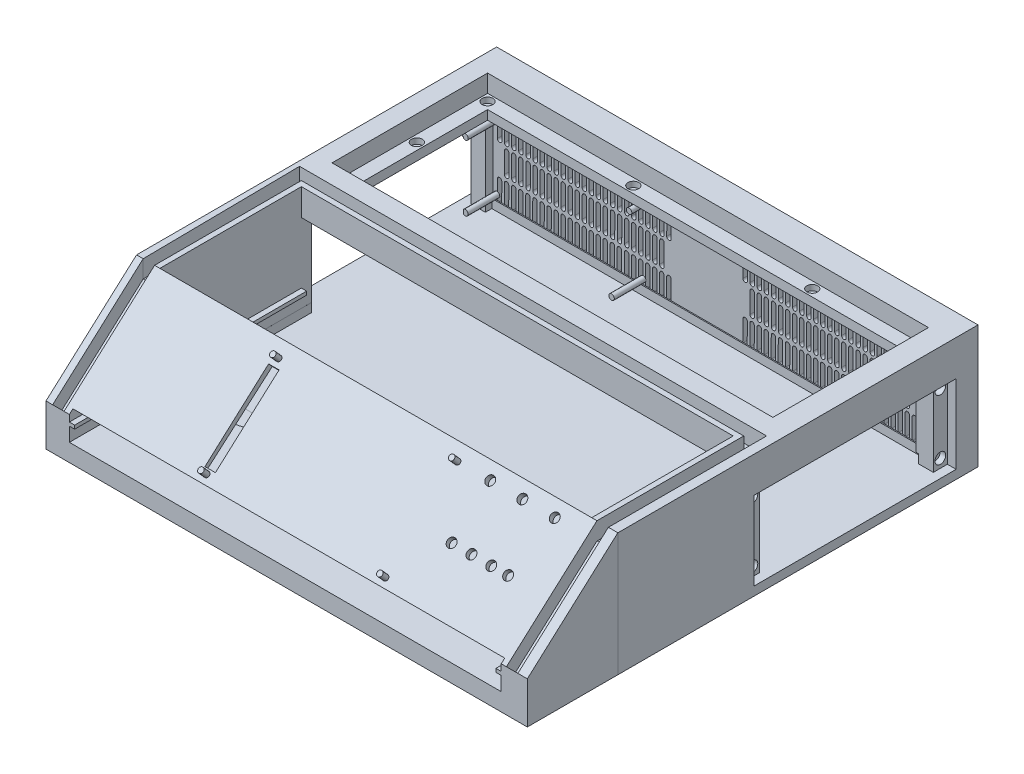
from build123d import *

# Parameters (mm, degrees)
BOSS_EXTRUDE1_DEPTH = 70
CUT_EXTRUDE1_DEPTH  = 10
SKETCH5_W           = 245.829798574
SKETCH5_H           = 84.902413675
CUT_EXTRUDE2_DEPTH  = 60
CUT_EXTRUDE3_DEPTH  = 4.66
CUT_EXTRUDE4_DEPTH  = 5
SKETCH9_W           = 3
SKETCH9_H           = 2
BOSS_EXTRUDE3_DEPTH = 85
SKETCH11_W          = 245.829798574
SKETCH11_H          = 44.743760381
CUT_EXTRUDE6_DEPTH  = 109
BOSS_EXTRUDE5_DEPTH = 274
SKETCH20_W          = 6.5
SKETCH20_H          = 69.236704604
CUT_EXTRUDE7_DEPTH  = 7.45
CUT_EXTRUDE9_DEPTH  = 346.159891301
SKETCH23_W          = 6.5
SKETCH23_H          = 69.236704604
CUT_EXTRUDE10_DEPTH = 7.45
CUT_EXTRUDE11_START = -5.5
CUT_EXTRUDE11_DEPTH = 243
CUT_EXTRUDE12_DEPTH = 5
CUT_EXTRUDE13_DEPTH = 5
SKETCH32_R          = 1.5
BOSS_EXTRUDE7_DEPTH = 5
SKETCH35_W          = 5.959514744
SKETCH35_H          = 48.700830397
CUT_EXTRUDE14_DEPTH = 10
SKETCH38_R          = 1.575
BOSS_EXTRUDE8_DEPTH = 18
SKETCH46_W          = 250.96666851
SKETCH46_H          = 88.54897829
CUT_EXTRUDE19_DEPTH = 10
SKETCH47_W          = 234.963937251
SKETCH47_H          = 72.547325464
CUT_EXTRUDE20_DEPTH = 19
SKETCH48_W          = 99
SKETCH48_H          = 44.740142715
CUT_EXTRUDE23_DEPTH = 37.5
SKETCH49_W          = 115.008314782
SKETCH49_H          = 44.740142715
CUT_EXTRUDE24_DEPTH = 5
SKETCH51_W          = 3
SKETCH51_H          = 6
CUT_EXTRUDE25_DEPTH = 5
SKETCH52_R          = 2.5
SKETCH52_R_2        = 2.496267115
CUT_EXTRUDE26_DEPTH = 5
SKETCH54_W          = 115.001673705
SKETCH54_H          = 44.740142715
CUT_EXTRUDE27_DEPTH = 5
SKETCH55_W          = 3
SKETCH55_H          = 6
CUT_EXTRUDE28_DEPTH = 5
SKETCH56_R          = 3.075
CUT_EXTRUDE29_DEPTH = 3.15
SKETCH57_R          = 3.075
CUT_EXTRUDE30_DEPTH = 3.15
CUT_EXTRUDE33_DEPTH = 15.44


with BuildPart() as part:
    # Sketch1 → Boss-Extrude1 (new body)
    with BuildSketch(Plane(origin=(0, 0, 0), x_dir=(1, 0, 0), z_dir=(0, 1, 0))):
        Polygon((263, -90), (0, -90), (-5.297672508, -90), (-5.297672508, 115), (268.719836564, 115), (268.719836564, 109.817232955), (268.719836564, 5.622236561), (268.719836564, -90), align=None)
    extrude(amount=BOSS_EXTRUDE1_DEPTH)

    # Sketch4 → Cut-Extrude1 (cut)
    with BuildSketch(Plane(origin=(0, 70, 0), x_dir=(1, 0, 0), z_dir=(0, 1, 0))):
        Polygon((-1.518607935, -90.000001141), (4.981392065, -90), (4.981392065, -6.438755439), (256.811190639, -6.438755439), (256.811190639, -90), (263.311190639, -90), (263.311190639, 0.061244561), (-2.567831993, 0.061244561), align=None)
    extrude(amount=-CUT_EXTRUDE1_DEPTH, mode=Mode.SUBTRACT)

    # Sketch5 → Cut-Extrude2 (cut)
    with BuildSketch(Plane(origin=(0, 70, 0), x_dir=(1, 0, 0), z_dir=(0, 1, 0))):
        with Locations((130.896291352, -51.889962277)):
            Rectangle(SKETCH5_W, SKETCH5_H)
    extrude(amount=-CUT_EXTRUDE2_DEPTH, mode=Mode.SUBTRACT)

    # Sketch6 → Cut-Extrude3 (cut)
    with BuildSketch(Plane(origin=(0, 10, 0), x_dir=(1, 0, 0), z_dir=(0, 1, 0))):
        with BuildLine():
            Line((34.259631344, -74.22492571), (34.259631344, -62.512880522))
            Line((34.259631344, -62.512880522), (56.559631344, -62.512880522))
            Line((56.559631344, -62.512880522), (56.559631344, -74.22492571))
            ThreePointArc((56.559631344, -74.22492571), (45.409631344, -85.37492571), (34.259631344, -74.22492571))
        make_face()
        with BuildLine():
            Line((120.707766281, -74.522104322), (120.707766281, -62.512880522))
            Line((120.707766281, -62.512880522), (143.007766281, -62.512880522))
            Line((143.007766281, -62.512880522), (143.007766281, -74.522104322))
            ThreePointArc((143.007766281, -74.522104322), (131.857766281, -85.672104322), (120.707766281, -74.522104322))
        make_face()
        with BuildLine():
            Line((206.833549657, -74.264123819), (206.833549657, -62.512880522))
            Line((206.833549657, -62.512880522), (229.133549657, -62.512880522))
            Line((229.133549657, -62.512880522), (229.133549657, -74.264123819))
            ThreePointArc((229.133549657, -74.264123819), (217.983549657, -85.414123819), (206.833549657, -74.264123819))
        make_face()
    extrude(amount=-CUT_EXTRUDE3_DEPTH, mode=Mode.SUBTRACT)

    # Sketch7 → Cut-Extrude4 (cut)
    with BuildSketch(Plane(origin=(0, 10, 0), x_dir=(1, 0, 0), z_dir=(0, 1, 0))):
        Polygon((7.981392065, -70.253012436), (8, 98.962802173), (255.25, 98.962802173), (253.811190639, -70.717283821), align=None)
    extrude(amount=-CUT_EXTRUDE4_DEPTH, mode=Mode.SUBTRACT)

    # Sketch9 → Boss-Extrude3 (add)
    with BuildSketch(Plane.XY.offset(90)):
        with Locations((9.481392065, 19)):
            Rectangle(SKETCH9_W, SKETCH9_H)
    boss_extrude3 = extrude(amount=-BOSS_EXTRUDE3_DEPTH)

    # Mirror1: Boss-Extrude3 across plane
    add(boss_extrude3.mirror(Plane(origin=(130.896291352, 0, 0), x_dir=(0, 0, 1), z_dir=(1, 0, 0))))

    # Sketch11 → Cut-Extrude6 (cut)
    with BuildSketch(Plane.XY.offset(9.438755439)):
        with Locations((130.896291352, 32.371880191)):
            Rectangle(SKETCH11_W, SKETCH11_H)
    extrude(amount=-CUT_EXTRUDE6_DEPTH, mode=Mode.SUBTRACT)

    # Sketch19 → Boss-Extrude5 (add)
    with BuildSketch(Plane.ZY.offset(5.297672508)):
        Polygon((90, 70), (141.535887712, 23.763936779), (141.535887712, 0), (90, 0), align=None)
    extrude(amount=-BOSS_EXTRUDE5_DEPTH)

    # Sketch20 → Cut-Extrude7 (cut)
    with BuildSketch(Plane(origin=(0, 83.519631011, 74.93067668), x_dir=(1, 0, 0), z_dir=(0, 0.7443434520309503, 0.6677969941671259))):
        with Locations((260.061190639, -54.863473393)):
            Rectangle(SKETCH20_W, SKETCH20_H)
    extrude(amount=-CUT_EXTRUDE7_DEPTH, mode=Mode.SUBTRACT)

    # Sketch22 → Cut-Extrude9 (cut, through all)
    with BuildSketch(Plane(origin=(0, 0, 90), x_dir=(-1, 0, 0), z_dir=(0, 0, -1))):
        Polygon((-253.840928546, 22.97086858), (-253.840928546, 25.555278288), (-8.001338449, 25.555278288), (-8.001338449, 22.97086858), (-8.001338449, 19.995349822), (-11.001338449, 19.995349822), (-11.001338449, 17.978106602), (-8.001338449, 17.978106602), (-8.001338449, 10), (-253.840928546, 10), (-253.840928546, 18), (-250.840928546, 18), (-250.840928546, 20), (-253.840928546, 20), align=None)
    extrude(amount=-CUT_EXTRUDE9_DEPTH, mode=Mode.SUBTRACT)

    # Sketch23 → Cut-Extrude10 (cut)
    with BuildSketch(Plane(origin=(0, 83.519631011, 74.93067668), x_dir=(1, 0, 0), z_dir=(0, 0.7443434520309503, 0.667796994167126))):
        with Locations((1.731392065, -54.863473393)):
            Rectangle(SKETCH23_W, SKETCH23_H)
    extrude(amount=-CUT_EXTRUDE10_DEPTH, mode=Mode.SUBTRACT)

    # Sketch26 → Cut-Extrude11 (cut)
    with BuildSketch(Plane.ZY.offset(-4.981392065).offset(CUT_EXTRUDE11_START)):
        Polygon((88.641700654, 66.783619732), (134.470436586, 26.948873274), (134.470436586, 21.410807665), (88.641700654, 21.3490784), align=None)
    extrude(amount=-CUT_EXTRUDE11_DEPTH, mode=Mode.SUBTRACT)

    # Sketch30 → Cut-Extrude12 (cut)
    with BuildSketch(Plane(origin=(0, 10, 0), x_dir=(1, 0, 0), z_dir=(0, 1, 0))):
        Polygon((88.314745977, -77.905708578), (84.07588093, -77.905708578), (84.07588093, -74.335398656), (84.57588093, -74.335398656), (84.57588093, -69.534898582), (87.804476446, -69.534898582), (87.804476446, -74.335398656), (88.314745977, -74.335398656), align=None)
    extrude(amount=-CUT_EXTRUDE12_DEPTH, mode=Mode.SUBTRACT)

    # Sketch31 → Cut-Extrude13 (cut)
    with BuildSketch(Plane(origin=(0, 10, 0), x_dir=(1, 0, 0), z_dir=(0, 1, 0))):
        Polygon((179.452231856, -78.850570011), (175.213366808, -78.850570011), (175.213366808, -75.280260088), (175.713366808, -75.280260088), (175.713366808, -70.479760014), (178.941962324, -70.479760014), (178.941962324, -75.280260088), (179.452231856, -75.280260088), align=None)
    extrude(amount=-CUT_EXTRUDE13_DEPTH, mode=Mode.SUBTRACT)

    # Sketch32 → Boss-Extrude7 (add)
    with BuildSketch(Plane(origin=(0, 83.519631011, 74.93067668), x_dir=(1, 0, 0), z_dir=(0, 0.7443434520309503, 0.667796994167126))):
        with Locations((81.180008505, -27.716796443)):
            Circle(SKETCH32_R)
        with Locations((81.180008505, -82.709942193)):
            Circle(SKETCH32_R)
        with Locations((183.023154256, -82.709942193)):
            Circle(SKETCH32_R)
        with Locations((183.023154256, -27.716796443)):
            Circle(SKETCH32_R)
    extrude(amount=BOSS_EXTRUDE7_DEPTH)

    # Sketch35 → Cut-Extrude14 (cut)
    with BuildSketch(Plane(origin=(0, 83.519631011, 74.93067668), x_dir=(1, 0, 0), z_dir=(0, 0.7443434520309503, 0.667796994167126))):
        with Locations((81.377076755, -56.021290861)):
            Rectangle(SKETCH35_W, SKETCH35_H)
    extrude(amount=-CUT_EXTRUDE14_DEPTH, mode=Mode.SUBTRACT)

    # Sketch38 → Boss-Extrude8 (add)
    with BuildSketch(Plane.XY.offset(-99.561244561)):
        with Locations((10.341559759, 12.837320316)):
            Circle(SKETCH38_R)
        with Locations((10.341559759, 50.187320316)):
            Circle(SKETCH38_R)
        with Locations((93.541559759, 12.837320316)):
            Circle(SKETCH38_R)
        with Locations((93.541559759, 50.187320316)):
            Circle(SKETCH38_R)
    extrude(amount=BOSS_EXTRUDE8_DEPTH)

    # Sketch46 → Cut-Extrude19 (cut)
    with BuildSketch(Plane(origin=(0, 70, 0), x_dir=(1, 0, 0), z_dir=(0, 1, 0))):
        with Locations((130.46472632, 55.286755416)):
            Rectangle(SKETCH46_W, SKETCH46_H)
    extrude(amount=-CUT_EXTRUDE19_DEPTH, mode=Mode.SUBTRACT)

    # Sketch47 → Cut-Extrude20 (cut)
    with BuildSketch(Plane(origin=(0, 60, 0), x_dir=(1, 0, 0), z_dir=(0, 1, 0))):
        with Locations((130.464726321, 55.286755416)):
            Rectangle(SKETCH47_W, SKETCH47_H)
    extrude(amount=-CUT_EXTRUDE20_DEPTH, mode=Mode.SUBTRACT)

    # Sketch48 → Cut-Extrude23 (cut)
    with BuildSketch(Plane.ZY.offset(-253.811190639)):
        with Locations((-45.061244561, 27.370071358)):
            Rectangle(SKETCH48_W, SKETCH48_H)
    cut_extrude23 = extrude(amount=-CUT_EXTRUDE23_DEPTH, mode=Mode.SUBTRACT)

    # Sketch49 → Cut-Extrude24 (cut)
    with BuildSketch(Plane(origin=(268.719836564, 0, 0), x_dir=(0, 0, -1), z_dir=(1, 0, 0))):
        with Locations((45.061244561, 27.370071358)):
            Rectangle(SKETCH49_W, SKETCH49_H)
    extrude(amount=-CUT_EXTRUDE24_DEPTH, mode=Mode.SUBTRACT)

    # Sketch51 → Cut-Extrude25 (cut)
    with BuildSketch(Plane(origin=(0, 0, 12.44291283), x_dir=(-1, 0, 0), z_dir=(0, 0, -1))):
        with Locations((-266.219836564, 38.555107036)):
            Rectangle(SKETCH51_W, SKETCH51_H)
        with Locations((-266.219836564, 16.185035679)):
            Rectangle(SKETCH51_W, SKETCH51_H)
    extrude(amount=-CUT_EXTRUDE25_DEPTH, mode=Mode.SUBTRACT)

    # Sketch52 → Cut-Extrude26 (cut)
    with BuildSketch(Plane(origin=(0, 83.519631011, 74.93067668), x_dir=(1, 0, 0), z_dir=(0, 0.7443434520309503, 0.667796994167126))):
        with Locations((201.623437155, -27.716796443)):
            Circle(SKETCH52_R)
        with Locations((219.917172447, -27.716796443)):
            Circle(SKETCH52_R)
        with Locations((238.364181543, -27.716796443)):
            Circle(SKETCH52_R)
        with Locations((212.919064307, -57.258078985)):
            Circle(SKETCH52_R)
        with Locations((224.201483548, -57.258078985)):
            Circle(SKETCH52_R_2)
        with Locations((201.623437155, -57.258078985)):
            Circle(SKETCH52_R)
        with Locations((233.778350435, -57.258078985)):
            Circle(SKETCH52_R)
    extrude(amount=-CUT_EXTRUDE26_DEPTH, mode=Mode.SUBTRACT)

    # Mirror5: Cut-Extrude23 across plane
    add(cut_extrude23.mirror(Plane(origin=(131.375620282, 0, 0.38196174), x_dir=(-0.0029073897035308822, 0, 0.9999957735336243), z_dir=(-0.9999957735336245, 0, -0.0029073897035308822))), mode=Mode.SUBTRACT)

    # Sketch54 → Cut-Extrude27 (cut)
    with BuildSketch(Plane.ZY.offset(5.297672508)):
        with Locations((-45.856747955, 27.370071358)):
            Rectangle(SKETCH54_W, SKETCH54_H)
    extrude(amount=-CUT_EXTRUDE27_DEPTH, mode=Mode.SUBTRACT)

    # Sketch55 → Cut-Extrude28 (cut)
    with BuildSketch(Plane(origin=(0, 0, 11.644088898), x_dir=(-1, 0, 0), z_dir=(0, 0, -1))):
        with Locations((2.723443809, 39.496335497)):
            Rectangle(SKETCH55_W, SKETCH55_H)
        with Locations((2.723443809, 17.12626414)):
            Rectangle(SKETCH55_W, SKETCH55_H)
    extrude(amount=-CUT_EXTRUDE28_DEPTH, mode=Mode.SUBTRACT)

    # Sketch56 → Cut-Extrude29 (cut)
    with BuildSketch(Plane(origin=(0, 60, 0), x_dir=(1, 0, 0), z_dir=(0, 1, 0))):
        with Locations((8.98207488, 95.560831355)):
            Circle(SKETCH56_R)
        with Locations((8.98207488, 55.286755416)):
            Circle(SKETCH56_R)
        with Locations((8.98207488, 15.012679477)):
            Circle(SKETCH56_R)
        with Locations((91.966559759, 15.012679477)):
            Circle(SKETCH56_R)
        with Locations((193.801312563, 15.012679477)):
            Circle(SKETCH56_R)
        with Locations((251.94737776, 15.012679477)):
            Circle(SKETCH56_R)
        with Locations((251.94737776, 55.286755416)):
            Circle(SKETCH56_R)
        with Locations((251.94737776, 95.560831355)):
            Circle(SKETCH56_R)
        with Locations((193.801312563, 95.560831355)):
            Circle(SKETCH56_R)
        with Locations((91.966559759, 95.560831355)):
            Circle(SKETCH56_R)
    extrude(amount=-CUT_EXTRUDE29_DEPTH, mode=Mode.SUBTRACT)

    # Sketch57 → Cut-Extrude30 (cut)
    with BuildSketch(Plane(origin=(263.719836564, 0, 0), x_dir=(0, 0, -1), z_dir=(1, 0, 0))):
        with Locations((-8.440834134, 44.268535884)):
            Circle(SKETCH57_R)
        with Locations((-8.440834134, 10)):
            Circle(SKETCH57_R)
        with Locations((98.563323257, 44.268535884)):
            Circle(SKETCH57_R)
        with Locations((98.563323257, 10)):
            Circle(SKETCH57_R)
    cut_extrude30 = extrude(amount=-CUT_EXTRUDE30_DEPTH, mode=Mode.SUBTRACT)

    # Mirror6: Cut-Extrude23, Cut-Extrude30 across plane
    add(cut_extrude23.mirror(Plane(origin=(131.375620282, 0, 0.38196174), x_dir=(-0.0029073897035308822, 0, 0.9999957735336243), z_dir=(-0.9999957735336245, 0, -0.0029073897035308822))), mode=Mode.SUBTRACT)
    add(cut_extrude30.mirror(Plane(origin=(131.375620282, 0, 0.38196174), x_dir=(-0.0029073897035308822, 0, 0.9999957735336243), z_dir=(-0.9999957735336245, 0, -0.0029073897035308822))), mode=Mode.SUBTRACT)

    # Sketch60 → Cut-Extrude33 (cut)
    with BuildSketch(Plane(origin=(0, 0, -115), x_dir=(-1, 0, 0), z_dir=(0, 0, -1))):
        with BuildLine():
            Line((-249.159484018, 9.54937519), (-249.220952032, 21.420747486))
            ThreePointArc((-249.220952032, 21.420747486), (-247.955896105, 22.698972102), (-246.677671489, 21.433916174))
            Line((-246.677671489, 21.433916174), (-246.616203476, 9.562543878))
            ThreePointArc((-246.616203476, 9.562543878), (-247.881259403, 8.284319262), (-249.159484018, 9.54937519))
        make_face()
        with BuildLine():
            Line((-245.134484278, 9.491544331), (-245.195952292, 21.362916627))
            ThreePointArc((-245.195952292, 21.362916627), (-243.930896365, 22.641141243), (-242.652671749, 21.376085316))
            Line((-242.652671749, 21.376085316), (-242.591203735, 9.504713019))
            ThreePointArc((-242.591203735, 9.504713019), (-243.856259663, 8.226488404), (-245.134484278, 9.491544331))
        make_face()
        with BuildLine():
            Line((-241.14188779, 9.547292216), (-241.203355803, 21.418664512))
            ThreePointArc((-241.203355803, 21.418664512), (-239.938299876, 22.696889128), (-238.660075261, 21.431833201))
            Line((-238.660075261, 21.431833201), (-238.598607247, 9.560460904))
            ThreePointArc((-238.598607247, 9.560460904), (-239.863663174, 8.282236289), (-241.14188779, 9.547292216))
        make_face()
        with BuildLine():
            Line((-237.148701325, 9.523553629), (-237.210169338, 21.394925925))
            ThreePointArc((-237.210169338, 21.394925925), (-235.945113411, 22.673150541), (-234.666888796, 21.408094613))
            Line((-234.666888796, 21.408094613), (-234.605420782, 9.536722317))
            ThreePointArc((-234.605420782, 9.536722317), (-235.870476709, 8.258497702), (-237.148701325, 9.523553629))
        make_face()
        with BuildLine():
            Line((-233.156104836, 9.579301514), (-233.21757285, 21.45067381))
            ThreePointArc((-233.21757285, 21.45067381), (-231.952516923, 22.728898426), (-230.674292307, 21.463842498))
            Line((-230.674292307, 21.463842498), (-230.612824294, 9.592470202))
            ThreePointArc((-230.612824294, 9.592470202), (-231.877880221, 8.314245586), (-233.156104836, 9.579301514))
        make_face()
        with BuildLine():
            Line((-229.117369553, 9.584775879), (-229.178837566, 21.456148176))
            ThreePointArc((-229.178837566, 21.456148176), (-227.913781639, 22.734372791), (-226.635557023, 21.469316864))
            Line((-226.635557023, 21.469316864), (-226.57408901, 9.597944568))
            ThreePointArc((-226.57408901, 9.597944568), (-227.839144937, 8.319719952), (-229.117369553, 9.584775879))
        make_face()
        with BuildLine():
            Line((-225.124773064, 9.640523764), (-225.186241078, 21.511896061))
            ThreePointArc((-225.186241078, 21.511896061), (-223.921185151, 22.790120676), (-222.642960535, 21.525064749))
            Line((-222.642960535, 21.525064749), (-222.581492522, 9.653692453))
            ThreePointArc((-222.581492522, 9.653692453), (-223.846548449, 8.375467837), (-225.124773064, 9.640523764))
        make_face()
        with BuildLine():
            Line((-221.02975139, 9.601683934), (-221.091219404, 21.47305623))
            ThreePointArc((-221.091219404, 21.47305623), (-219.826163477, 22.751280846), (-218.547938861, 21.486224919))
            Line((-218.547938861, 21.486224919), (-218.486470848, 9.614852622))
            ThreePointArc((-218.486470848, 9.614852622), (-219.751526775, 8.336628007), (-221.02975139, 9.601683934))
        make_face()
        with BuildLine():
            Line((-217.037154902, 9.657431819), (-217.098622916, 21.528804115))
            ThreePointArc((-217.098622916, 21.528804115), (-215.833566988, 22.807028731), (-214.555342373, 21.541972804))
            Line((-214.555342373, 21.541972804), (-214.493874359, 9.670600507))
            ThreePointArc((-214.493874359, 9.670600507), (-215.758930286, 8.392375892), (-217.037154902, 9.657431819))
        make_face()
        with BuildLine():
            Line((-212.944281909, 9.529492242), (-213.005749922, 21.400864539))
            ThreePointArc((-213.005749922, 21.400864539), (-211.740693995, 22.679089154), (-210.46246938, 21.414033227))
            Line((-210.46246938, 21.414033227), (-210.401001366, 9.542660931))
            ThreePointArc((-210.401001366, 9.542660931), (-211.666057293, 8.264436315), (-212.944281909, 9.529492242))
        make_face()
        with BuildLine():
            Line((-208.95168542, 9.585240127), (-209.013153434, 21.456612423))
            ThreePointArc((-209.013153434, 21.456612423), (-207.748097507, 22.734837039), (-206.469872891, 21.469781112))
            Line((-206.469872891, 21.469781112), (-206.408404878, 9.598408816))
            ThreePointArc((-206.408404878, 9.598408816), (-207.673460805, 8.3201842), (-208.95168542, 9.585240127))
        make_face()
        with BuildLine():
            Line((-196.978518724, 9.549570169), (-197.039986737, 21.420942465))
            ThreePointArc((-197.039986737, 21.420942465), (-195.77493081, 22.69916708), (-194.496706195, 21.434111153))
            Line((-194.496706195, 21.434111153), (-194.435238181, 9.562738857))
            ThreePointArc((-194.435238181, 9.562738857), (-195.700294108, 8.284514241), (-196.978518724, 9.549570169))
        make_face()
        with BuildLine():
            Line((-192.985922236, 9.605318053), (-193.047390249, 21.47669035))
            ThreePointArc((-193.047390249, 21.47669035), (-191.782334322, 22.754914965), (-190.504109706, 21.489859038))
            Line((-190.504109706, 21.489859038), (-190.442641693, 9.618486742))
            ThreePointArc((-190.442641693, 9.618486742), (-191.70769762, 8.340262126), (-192.985922236, 9.605318053))
        make_face()
        with BuildLine():
            Line((-188.960922495, 9.547487195), (-189.022390509, 21.418859491))
            ThreePointArc((-189.022390509, 21.418859491), (-187.757334582, 22.697084107), (-186.479109966, 21.43202818))
            Line((-186.479109966, 21.43202818), (-186.417641953, 9.560655883))
            ThreePointArc((-186.417641953, 9.560655883), (-187.68269788, 8.282431268), (-188.960922495, 9.547487195))
        make_face()
        with BuildLine():
            Line((-184.968326007, 9.60323508), (-185.029794021, 21.474607376))
            ThreePointArc((-185.029794021, 21.474607376), (-183.764738094, 22.752831992), (-182.486513478, 21.487776064))
            Line((-182.486513478, 21.487776064), (-182.425045464, 9.616403768))
            ThreePointArc((-182.425045464, 9.616403768), (-183.690101392, 8.338179153), (-184.968326007, 9.60323508))
        make_face()
        with BuildLine():
            Line((-180.975139542, 9.579496493), (-181.036607556, 21.450868789))
            ThreePointArc((-181.036607556, 21.450868789), (-179.771551628, 22.729093404), (-178.493327013, 21.464037477))
            Line((-178.493327013, 21.464037477), (-178.431858999, 9.592665181))
            ThreePointArc((-178.431858999, 9.592665181), (-179.696914926, 8.314440565), (-180.975139542, 9.579496493))
        make_face()
        with BuildLine():
            Line((-176.982543054, 9.635244377), (-177.044011067, 21.506616674))
            ThreePointArc((-177.044011067, 21.506616674), (-175.77895514, 22.784841289), (-174.500730524, 21.519785362))
            Line((-174.500730524, 21.519785362), (-174.439262511, 9.648413066))
            ThreePointArc((-174.439262511, 9.648413066), (-175.704318438, 8.37018845), (-176.982543054, 9.635244377))
        make_face()
        with BuildLine():
            Line((-205.005548151, 9.557405131), (-205.067016165, 21.428777428))
            ThreePointArc((-205.067016165, 21.428777428), (-203.801960238, 22.707002043), (-202.523735622, 21.441946116))
            Line((-202.523735622, 21.441946116), (-202.462267609, 9.57057382))
            ThreePointArc((-202.462267609, 9.57057382), (-203.727323536, 8.292349204), (-205.005548151, 9.557405131))
        make_face()
        with BuildLine():
            Line((-201.012951663, 9.613153016), (-201.074419677, 21.484525313))
            ThreePointArc((-201.074419677, 21.484525313), (-199.809363749, 22.762749928), (-198.531139134, 21.497694001))
            Line((-198.531139134, 21.497694001), (-198.46967112, 9.626321705))
            ThreePointArc((-198.46967112, 9.626321705), (-199.734727047, 8.348097089), (-201.012951663, 9.613153016))
        make_face()
        with BuildLine():
            Line((-172.94380777, 9.640718743), (-173.005275783, 21.512091039))
            ThreePointArc((-173.005275783, 21.512091039), (-171.740219856, 22.790315655), (-170.461995241, 21.525259728))
            Line((-170.461995241, 21.525259728), (-170.400527227, 9.653887432))
            ThreePointArc((-170.400527227, 9.653887432), (-171.665583154, 8.375662816), (-172.94380777, 9.640718743))
        make_face()
        with BuildLine():
            Line((-168.951211282, 9.696466628), (-169.012679295, 21.567838924))
            ThreePointArc((-169.012679295, 21.567838924), (-167.747623368, 22.84606354), (-166.469398752, 21.581007613))
            Line((-166.469398752, 21.581007613), (-166.407930739, 9.709635316))
            ThreePointArc((-166.407930739, 9.709635316), (-167.672986666, 8.431410701), (-168.951211282, 9.696466628))
        make_face()
        with BuildLine():
            Line((-164.856189608, 9.657626798), (-164.917657621, 21.528999094))
            ThreePointArc((-164.917657621, 21.528999094), (-163.652601694, 22.80722371), (-162.374377078, 21.542167783))
            Line((-162.374377078, 21.542167783), (-162.312909065, 9.670795486))
            ThreePointArc((-162.312909065, 9.670795486), (-163.577964992, 8.392570871), (-164.856189608, 9.657626798))
        make_face()
        with BuildLine():
            Line((-160.863593119, 9.713374683), (-160.925061133, 21.584746979))
            ThreePointArc((-160.925061133, 21.584746979), (-159.660005206, 22.862971595), (-158.38178059, 21.597915667))
            Line((-158.38178059, 21.597915667), (-158.320312577, 9.726543371))
            ThreePointArc((-158.320312577, 9.726543371), (-159.585368504, 8.448318756), (-160.863593119, 9.713374683))
        make_face()
        with BuildLine():
            Line((-156.770720126, 9.585435106), (-156.832188139, 21.456807402))
            ThreePointArc((-156.832188139, 21.456807402), (-155.567132212, 22.735032018), (-154.288907597, 21.469976091))
            Line((-154.288907597, 21.469976091), (-154.227439583, 9.598603794))
            ThreePointArc((-154.227439583, 9.598603794), (-155.49249551, 8.320379179), (-156.770720126, 9.585435106))
        make_face()
        with BuildLine():
            Line((-152.778123638, 9.641182991), (-152.839591651, 21.512555287))
            ThreePointArc((-152.839591651, 21.512555287), (-151.574535724, 22.790779903), (-150.296311108, 21.525723976))
            Line((-150.296311108, 21.525723976), (-150.234843095, 9.654351679))
            ThreePointArc((-150.234843095, 9.654351679), (-151.499899022, 8.376127064), (-152.778123638, 9.641182991))
        make_face()
        with BuildLine():
            Line((-245.214727534, 25.50584578), (-245.276195548, 37.377218076))
            ThreePointArc((-245.276195548, 37.377218076), (-244.011139621, 38.655442692), (-242.732915005, 37.390386764))
            Line((-242.732915005, 37.390386764), (-242.671446992, 25.519014468))
            ThreePointArc((-242.671446992, 25.519014468), (-243.936502919, 24.240789852), (-245.214727534, 25.50584578))
        make_face()
        with BuildLine():
            Line((-241.222131046, 25.561593664), (-241.28359906, 37.432965961))
            ThreePointArc((-241.28359906, 37.432965961), (-240.018543132, 38.711190576), (-238.740318517, 37.446134649))
            Line((-238.740318517, 37.446134649), (-238.678850503, 25.574762353))
            ThreePointArc((-238.678850503, 25.574762353), (-239.94390643, 24.296537737), (-241.222131046, 25.561593664))
        make_face()
        with BuildLine():
            Line((-237.228944581, 25.537855077), (-237.290412594, 37.409227374))
            ThreePointArc((-237.290412594, 37.409227374), (-236.025356667, 38.687451989), (-234.747132052, 37.422396062))
            Line((-234.747132052, 37.422396062), (-234.685664038, 25.551023766))
            ThreePointArc((-234.685664038, 25.551023766), (-235.950719965, 24.27279915), (-237.228944581, 25.537855077))
        make_face()
        with BuildLine():
            Line((-233.236348093, 25.593602962), (-233.297816106, 37.464975259))
            ThreePointArc((-233.297816106, 37.464975259), (-232.032760179, 38.743199874), (-230.754535563, 37.478143947))
            Line((-230.754535563, 37.478143947), (-230.69306755, 25.606771651))
            ThreePointArc((-230.69306755, 25.606771651), (-231.958123477, 24.328547035), (-233.236348093, 25.593602962))
        make_face()
        with BuildLine():
            Line((-109.396509909, 8.700901419), (-109.457977922, 20.572273715))
            ThreePointArc((-109.457977922, 20.572273715), (-108.192921995, 21.850498331), (-106.91469738, 20.585442404))
            Line((-106.91469738, 20.585442404), (-106.853229366, 8.714070108))
            ThreePointArc((-106.853229366, 8.714070108), (-108.118285293, 7.435845492), (-109.396509909, 8.700901419))
        make_face()
        with BuildLine():
            Line((-229.197612809, 25.599077328), (-229.259080822, 37.470449624))
            ThreePointArc((-229.259080822, 37.470449624), (-227.994024895, 38.74867424), (-226.71580028, 37.483618313))
            Line((-226.71580028, 37.483618313), (-226.654332266, 25.612246016))
            ThreePointArc((-226.654332266, 25.612246016), (-227.919388193, 24.334021401), (-229.197612809, 25.599077328))
        make_face()
        with BuildLine():
            Line((-225.20501632, 25.654825213), (-225.266484334, 37.526197509))
            ThreePointArc((-225.266484334, 37.526197509), (-224.001428407, 38.804422125), (-222.723203791, 37.539366198))
            Line((-222.723203791, 37.539366198), (-222.661735778, 25.667993901))
            ThreePointArc((-222.661735778, 25.667993901), (-223.926791705, 24.389769286), (-225.20501632, 25.654825213))
        make_face()
        with BuildLine():
            Line((-221.109994646, 25.615985383), (-221.17146266, 37.487357679))
            ThreePointArc((-221.17146266, 37.487357679), (-219.906406733, 38.765582295), (-218.628182117, 37.500526367))
            Line((-218.628182117, 37.500526367), (-218.566714104, 25.629154071))
            ThreePointArc((-218.566714104, 25.629154071), (-219.831770031, 24.350929455), (-221.109994646, 25.615985383))
        make_face()
        with BuildLine():
            Line((-217.117398158, 25.671733267), (-217.178866172, 37.543105564))
            ThreePointArc((-217.178866172, 37.543105564), (-215.913810245, 38.821330179), (-214.635585629, 37.556274252))
            Line((-214.635585629, 37.556274252), (-214.574117615, 25.684901956))
            ThreePointArc((-214.574117615, 25.684901956), (-215.839173543, 24.40667734), (-217.117398158, 25.671733267))
        make_face()
        with BuildLine():
            Line((-213.024525165, 25.543793691), (-213.085993178, 37.415165987))
            ThreePointArc((-213.085993178, 37.415165987), (-211.820937251, 38.693390603), (-210.542712636, 37.428334676))
            Line((-210.542712636, 37.428334676), (-210.481244622, 25.556962379))
            ThreePointArc((-210.481244622, 25.556962379), (-211.746300549, 24.278737764), (-213.024525165, 25.543793691))
        make_face()
        with BuildLine():
            Line((-209.031928677, 25.599541576), (-209.09339669, 37.470913872))
            ThreePointArc((-209.09339669, 37.470913872), (-207.828340763, 38.749138488), (-206.550116147, 37.48408256))
            Line((-206.550116147, 37.48408256), (-206.488648134, 25.612710264))
            ThreePointArc((-206.488648134, 25.612710264), (-207.753704061, 24.334485649), (-209.031928677, 25.599541576))
        make_face()
        with BuildLine():
            Line((-197.05876198, 25.563871617), (-197.120229994, 37.435243914))
            ThreePointArc((-197.120229994, 37.435243914), (-195.855174066, 38.713468529), (-194.576949451, 37.448412602))
            Line((-194.576949451, 37.448412602), (-194.515481437, 25.577040306))
            ThreePointArc((-194.515481437, 25.577040306), (-195.780537364, 24.29881569), (-197.05876198, 25.563871617))
        make_face()
        with BuildLine():
            Line((-193.066165492, 25.619619502), (-193.127633505, 37.490991798))
            ThreePointArc((-193.127633505, 37.490991798), (-191.862577578, 38.769216414), (-190.584352962, 37.504160487))
            Line((-190.584352962, 37.504160487), (-190.522884949, 25.63278819))
            ThreePointArc((-190.522884949, 25.63278819), (-191.787940876, 24.354563575), (-193.066165492, 25.619619502))
        make_face()
        with BuildLine():
            Line((-189.041165752, 25.561788643), (-189.102633765, 37.43316094))
            ThreePointArc((-189.102633765, 37.43316094), (-187.837577838, 38.711385555), (-186.559353222, 37.446329628))
            Line((-186.559353222, 37.446329628), (-186.497885209, 25.574957332))
            ThreePointArc((-186.497885209, 25.574957332), (-187.762941136, 24.296732716), (-189.041165752, 25.561788643))
        make_face()
        with BuildLine():
            Line((-185.048569263, 25.617536528), (-185.110037277, 37.488908825))
            ThreePointArc((-185.110037277, 37.488908825), (-183.84498135, 38.76713344), (-182.566756734, 37.502077513))
            Line((-182.566756734, 37.502077513), (-182.50528872, 25.630705217))
            ThreePointArc((-182.50528872, 25.630705217), (-183.770344648, 24.352480601), (-185.048569263, 25.617536528))
        make_face()
        with BuildLine():
            Line((-181.055382798, 25.593797941), (-181.116850812, 37.465170237))
            ThreePointArc((-181.116850812, 37.465170237), (-179.851794885, 38.743394853), (-178.573570269, 37.478338926))
            Line((-178.573570269, 37.478338926), (-178.512102255, 25.60696663))
            ThreePointArc((-178.512102255, 25.60696663), (-179.777158183, 24.328742014), (-181.055382798, 25.593797941))
        make_face()
        with BuildLine():
            Line((-177.06278631, 25.649545826), (-177.124254323, 37.520918122))
            ThreePointArc((-177.124254323, 37.520918122), (-175.859198396, 38.799142738), (-174.580973781, 37.534086811))
            Line((-174.580973781, 37.534086811), (-174.519505767, 25.662714514))
            ThreePointArc((-174.519505767, 25.662714514), (-175.784561694, 24.384489899), (-177.06278631, 25.649545826))
        make_face()
        with BuildLine():
            Line((-205.085791407, 25.57170658), (-205.147259421, 37.443078876))
            ThreePointArc((-205.147259421, 37.443078876), (-203.882203494, 38.721303492), (-202.603978878, 37.456247565))
            Line((-202.603978878, 37.456247565), (-202.542510865, 25.584875268))
            ThreePointArc((-202.542510865, 25.584875268), (-203.807566792, 24.306650653), (-205.085791407, 25.57170658))
        make_face()
        with BuildLine():
            Line((-201.093194919, 25.627454465), (-201.154662933, 37.498826761))
            ThreePointArc((-201.154662933, 37.498826761), (-199.889607005, 38.777051377), (-198.61138239, 37.51199545))
            Line((-198.61138239, 37.51199545), (-198.549914376, 25.640623153))
            ThreePointArc((-198.549914376, 25.640623153), (-199.814970303, 24.362398538), (-201.093194919, 25.627454465))
        make_face()
        with BuildLine():
            Line((-173.024051026, 25.655020192), (-173.08551904, 37.526392488))
            ThreePointArc((-173.08551904, 37.526392488), (-171.820463112, 38.804617104), (-170.542238497, 37.539561176))
            Line((-170.542238497, 37.539561176), (-170.480770483, 25.66818888))
            ThreePointArc((-170.480770483, 25.66818888), (-171.74582641, 24.389964265), (-173.024051026, 25.655020192))
        make_face()
        with BuildLine():
            Line((-169.031454538, 25.710768077), (-169.092922551, 37.582140373))
            ThreePointArc((-169.092922551, 37.582140373), (-167.827866624, 38.860364989), (-166.549642008, 37.595309061))
            Line((-166.549642008, 37.595309061), (-166.488173995, 25.723936765))
            ThreePointArc((-166.488173995, 25.723936765), (-167.753229922, 24.445712149), (-169.031454538, 25.710768077))
        make_face()
        with BuildLine():
            Line((-164.936432864, 25.671928246), (-164.997900877, 37.543300543))
            ThreePointArc((-164.997900877, 37.543300543), (-163.73284495, 38.821525158), (-162.454620334, 37.556469231))
            Line((-162.454620334, 37.556469231), (-162.393152321, 25.685096935))
            ThreePointArc((-162.393152321, 25.685096935), (-163.658208248, 24.406872319), (-164.936432864, 25.671928246))
        make_face()
        with BuildLine():
            Line((-160.943836375, 25.727676131), (-161.005304389, 37.599048428))
            ThreePointArc((-161.005304389, 37.599048428), (-159.740248462, 38.877273043), (-158.462023846, 37.612217116))
            Line((-158.462023846, 37.612217116), (-158.400555833, 25.74084482))
            ThreePointArc((-158.400555833, 25.74084482), (-159.66561176, 24.462620204), (-160.943836375, 25.727676131))
        make_face()
        with BuildLine():
            Line((-156.850963382, 25.599736555), (-156.912431396, 37.471108851))
            ThreePointArc((-156.912431396, 37.471108851), (-155.647375468, 38.749333467), (-154.369150853, 37.484277539))
            Line((-154.369150853, 37.484277539), (-154.307682839, 25.612905243))
            ThreePointArc((-154.307682839, 25.612905243), (-155.572738766, 24.334680627), (-156.850963382, 25.599736555))
        make_face()
        with BuildLine():
            Line((-249.267278891, 41.303946771), (-249.328746905, 53.175319068))
            ThreePointArc((-249.328746905, 53.175319068), (-248.063690978, 54.453543683), (-246.785466362, 53.188487756))
            Line((-246.785466362, 53.188487756), (-246.723998349, 41.31711546))
            ThreePointArc((-246.723998349, 41.31711546), (-247.989054276, 40.038890844), (-249.267278891, 41.303946771))
        make_face()
        with BuildLine():
            Line((-245.242279151, 41.246115913), (-245.303747165, 53.117488209))
            ThreePointArc((-245.303747165, 53.117488209), (-244.038691238, 54.395712825), (-242.760466622, 53.130656897))
            Line((-242.760466622, 53.130656897), (-242.698998609, 41.259284601))
            ThreePointArc((-242.698998609, 41.259284601), (-243.964054536, 39.981059985), (-245.242279151, 41.246115913))
        make_face()
        with BuildLine():
            Line((-241.249682663, 41.301863797), (-241.311150677, 53.173236094))
            ThreePointArc((-241.311150677, 53.173236094), (-240.046094749, 54.451460709), (-238.767870134, 53.186404782))
            Line((-238.767870134, 53.186404782), (-238.70640212, 41.315032486))
            ThreePointArc((-238.70640212, 41.315032486), (-239.971458047, 40.03680787), (-241.249682663, 41.301863797))
        make_face()
        with BuildLine():
            Line((-237.256496198, 41.27812521), (-237.317964211, 53.149497507))
            ThreePointArc((-237.317964211, 53.149497507), (-236.052908284, 54.427722122), (-234.774683669, 53.162666195))
            Line((-234.774683669, 53.162666195), (-234.713215655, 41.291293899))
            ThreePointArc((-234.713215655, 41.291293899), (-235.978271582, 40.013069283), (-237.256496198, 41.27812521))
        make_face()
        with BuildLine():
            Line((-233.26389971, 41.333873095), (-233.325367723, 53.205245392))
            ThreePointArc((-233.325367723, 53.205245392), (-232.060311796, 54.483470007), (-230.78208718, 53.21841408))
            Line((-230.78208718, 53.21841408), (-230.720619167, 41.347041784))
            ThreePointArc((-230.720619167, 41.347041784), (-231.985675094, 40.068817168), (-233.26389971, 41.333873095))
        make_face()
        with BuildLine():
            Line((-229.225164426, 41.339347461), (-229.286632439, 53.210719757))
            ThreePointArc((-229.286632439, 53.210719757), (-228.021576512, 54.488944373), (-226.743351897, 53.223888446))
            Line((-226.743351897, 53.223888446), (-226.681883883, 41.352516149))
            ThreePointArc((-226.681883883, 41.352516149), (-227.94693981, 40.074291534), (-229.225164426, 41.339347461))
        make_face()
        with BuildLine():
            Line((-225.232567937, 41.395095346), (-225.294035951, 53.266467642))
            ThreePointArc((-225.294035951, 53.266467642), (-224.028980024, 54.544692258), (-222.750755408, 53.279636331))
            Line((-222.750755408, 53.279636331), (-222.689287395, 41.408264034))
            ThreePointArc((-222.689287395, 41.408264034), (-223.954343322, 40.130039419), (-225.232567937, 41.395095346))
        make_face()
        with BuildLine():
            Line((-221.137546263, 41.356255516), (-221.199014277, 53.227627812))
            ThreePointArc((-221.199014277, 53.227627812), (-219.93395835, 54.505852428), (-218.655733734, 53.2407965))
            Line((-218.655733734, 53.2407965), (-218.594265721, 41.369424204))
            ThreePointArc((-218.594265721, 41.369424204), (-219.859321648, 40.091199588), (-221.137546263, 41.356255516))
        make_face()
        with BuildLine():
            Line((-217.144949775, 41.412003401), (-217.206417789, 53.283375697))
            ThreePointArc((-217.206417789, 53.283375697), (-215.941361862, 54.561600312), (-214.663137246, 53.296544385))
            Line((-214.663137246, 53.296544385), (-214.601669232, 41.425172089))
            ThreePointArc((-214.601669232, 41.425172089), (-215.86672516, 40.146947473), (-217.144949775, 41.412003401))
        make_face()
        with BuildLine():
            Line((-213.052076782, 41.284063824), (-213.113544795, 53.15543612))
            ThreePointArc((-213.113544795, 53.15543612), (-211.848488868, 54.433660736), (-210.570264253, 53.168604809))
            Line((-210.570264253, 53.168604809), (-210.508796239, 41.297232512))
            ThreePointArc((-210.508796239, 41.297232512), (-211.773852166, 40.019007897), (-213.052076782, 41.284063824))
        make_face()
        with BuildLine():
            Line((-209.059480293, 41.339811709), (-209.120948307, 53.211184005))
            ThreePointArc((-209.120948307, 53.211184005), (-207.85589238, 54.489408621), (-206.577667764, 53.224352693))
            Line((-206.577667764, 53.224352693), (-206.516199751, 41.352980397))
            ThreePointArc((-206.516199751, 41.352980397), (-207.781255678, 40.074755782), (-209.059480293, 41.339811709))
        make_face()
        with BuildLine():
            Line((-197.086313597, 41.30414175), (-197.147781611, 53.175514047))
            ThreePointArc((-197.147781611, 53.175514047), (-195.882725683, 54.453738662), (-194.604501068, 53.188682735))
            Line((-194.604501068, 53.188682735), (-194.543033054, 41.317310439))
            ThreePointArc((-194.543033054, 41.317310439), (-195.808088981, 40.039085823), (-197.086313597, 41.30414175))
        make_face()
        with BuildLine():
            Line((-193.093717109, 41.359889635), (-193.155185122, 53.231261931))
            ThreePointArc((-193.155185122, 53.231261931), (-191.890129195, 54.509486547), (-190.611904579, 53.24443062))
            Line((-190.611904579, 53.24443062), (-190.550436566, 41.373058323))
            ThreePointArc((-190.550436566, 41.373058323), (-191.815492493, 40.094833708), (-193.093717109, 41.359889635))
        make_face()
        with BuildLine():
            Line((-189.068717369, 41.302058776), (-189.130185382, 53.173431073))
            ThreePointArc((-189.130185382, 53.173431073), (-187.865129455, 54.451655688), (-186.586904839, 53.186599761))
            Line((-186.586904839, 53.186599761), (-186.525436826, 41.315227465))
            ThreePointArc((-186.525436826, 41.315227465), (-187.790492753, 40.037002849), (-189.068717369, 41.302058776))
        make_face()
        with BuildLine():
            Line((-185.07612088, 41.357806661), (-185.137588894, 53.229178958))
            ThreePointArc((-185.137588894, 53.229178958), (-183.872532967, 54.507403573), (-182.594308351, 53.242347646))
            Line((-182.594308351, 53.242347646), (-182.532840337, 41.37097535))
            ThreePointArc((-182.532840337, 41.37097535), (-183.797896265, 40.092750734), (-185.07612088, 41.357806661))
        make_face()
        with BuildLine():
            Line((-181.082934415, 41.334068074), (-181.144402429, 53.20544037))
            ThreePointArc((-181.144402429, 53.20544037), (-179.879346501, 54.483664986), (-178.601121886, 53.218609059))
            Line((-178.601121886, 53.218609059), (-178.539653872, 41.347236763))
            ThreePointArc((-178.539653872, 41.347236763), (-179.8047098, 40.069012147), (-181.082934415, 41.334068074))
        make_face()
        with BuildLine():
            Line((-177.090337927, 41.389815959), (-177.15180594, 53.261188255))
            ThreePointArc((-177.15180594, 53.261188255), (-175.886750013, 54.539412871), (-174.608525398, 53.274356944))
            Line((-174.608525398, 53.274356944), (-174.547057384, 41.402984647))
            ThreePointArc((-174.547057384, 41.402984647), (-175.812113311, 40.124760032), (-177.090337927, 41.389815959))
        make_face()
        with BuildLine():
            Line((-205.113343024, 41.311976713), (-205.174811038, 53.183349009))
            ThreePointArc((-205.174811038, 53.183349009), (-203.909755111, 54.461573625), (-202.631530495, 53.196517698))
            Line((-202.631530495, 53.196517698), (-202.570062482, 41.325145401))
            ThreePointArc((-202.570062482, 41.325145401), (-203.835118409, 40.046920786), (-205.113343024, 41.311976713))
        make_face()
        with BuildLine():
            Line((-201.120746536, 41.367724598), (-201.18221455, 53.239096894))
            ThreePointArc((-201.18221455, 53.239096894), (-199.917158622, 54.51732151), (-198.638934007, 53.252265583))
            Line((-198.638934007, 53.252265583), (-198.577465993, 41.380893286))
            ThreePointArc((-198.577465993, 41.380893286), (-199.84252192, 40.102668671), (-201.120746536, 41.367724598))
        make_face()
        with BuildLine():
            Line((-173.051602643, 41.395290325), (-173.113070657, 53.266662621))
            ThreePointArc((-173.113070657, 53.266662621), (-171.848014729, 54.544887237), (-170.569790114, 53.27983131))
            Line((-170.569790114, 53.27983131), (-170.5083221, 41.408459013))
            ThreePointArc((-170.5083221, 41.408459013), (-171.773378027, 40.130234398), (-173.051602643, 41.395290325))
        make_face()
        with BuildLine():
            Line((-169.059006155, 41.45103821), (-169.120474168, 53.322410506))
            ThreePointArc((-169.120474168, 53.322410506), (-167.855418241, 54.600635122), (-166.577193625, 53.335579194))
            Line((-166.577193625, 53.335579194), (-166.515725612, 41.464206898))
            ThreePointArc((-166.515725612, 41.464206898), (-167.780781539, 40.185982282), (-169.059006155, 41.45103821))
        make_face()
        with BuildLine():
            Line((-164.963984481, 41.412198379), (-165.025452494, 53.283570676))
            ThreePointArc((-165.025452494, 53.283570676), (-163.760396567, 54.561795291), (-162.482171951, 53.296739364))
            Line((-162.482171951, 53.296739364), (-162.420703938, 41.425367068))
            ThreePointArc((-162.420703938, 41.425367068), (-163.685759865, 40.147142452), (-164.963984481, 41.412198379))
        make_face()
        with BuildLine():
            Line((-160.971387992, 41.467946264), (-161.032856006, 53.339318561))
            ThreePointArc((-161.032856006, 53.339318561), (-159.767800079, 54.617543176), (-158.489575463, 53.352487249))
            Line((-158.489575463, 53.352487249), (-158.42810745, 41.481114953))
            ThreePointArc((-158.42810745, 41.481114953), (-159.693163377, 40.202890337), (-160.971387992, 41.467946264))
        make_face()
        with BuildLine():
            Line((-156.878514999, 41.340006688), (-156.939983013, 53.211378984))
            ThreePointArc((-156.939983013, 53.211378984), (-155.674927085, 54.4896036), (-154.39670247, 53.224547672))
            Line((-154.39670247, 53.224547672), (-154.335234456, 41.353175376))
            ThreePointArc((-154.335234456, 41.353175376), (-155.600290383, 40.07495076), (-156.878514999, 41.340006688))
        make_face()
        with BuildLine():
            Line((-152.885918511, 41.395754572), (-152.947386524, 53.267126869))
            ThreePointArc((-152.947386524, 53.267126869), (-151.682330597, 54.545351484), (-150.404105982, 53.280295557))
            Line((-150.404105982, 53.280295557), (-150.342637968, 41.408923261))
            ThreePointArc((-150.342637968, 41.408923261), (-151.607693895, 40.130698645), (-152.885918511, 41.395754572))
        make_face()
        with BuildLine():
            Line((-105.371510169, 8.64307056), (-105.432978182, 20.514442857))
            ThreePointArc((-105.432978182, 20.514442857), (-104.167922255, 21.792667472), (-102.889697639, 20.527611545))
            Line((-102.889697639, 20.527611545), (-102.828229626, 8.656239249))
            ThreePointArc((-102.828229626, 8.656239249), (-104.093285553, 7.378014633), (-105.371510169, 8.64307056))
        make_face()
        with BuildLine():
            Line((-101.37891368, 8.698818445), (-101.440381694, 20.570190742))
            ThreePointArc((-101.440381694, 20.570190742), (-100.175325767, 21.848415357), (-98.897101151, 20.58335943))
            Line((-98.897101151, 20.58335943), (-98.835633138, 8.711987134))
            ThreePointArc((-98.835633138, 8.711987134), (-100.100689065, 7.433762518), (-101.37891368, 8.698818445))
        make_face()
        with BuildLine():
            Line((-97.385727215, 8.675079858), (-97.447195229, 20.546452155))
            ThreePointArc((-97.447195229, 20.546452155), (-96.182139302, 21.82467677), (-94.903914686, 20.559620843))
            Line((-94.903914686, 20.559620843), (-94.842446672, 8.688248547))
            ThreePointArc((-94.842446672, 8.688248547), (-96.1075026, 7.410023931), (-97.385727215, 8.675079858))
        make_face()
        with BuildLine():
            Line((-93.393130727, 8.730827743), (-93.45459874, 20.602200039))
            ThreePointArc((-93.45459874, 20.602200039), (-92.189542813, 21.880424655), (-90.911318198, 20.615368728))
            Line((-90.911318198, 20.615368728), (-90.849850184, 8.743996431))
            ThreePointArc((-90.849850184, 8.743996431), (-92.114906111, 7.465771816), (-93.393130727, 8.730827743))
        make_face()
        with BuildLine():
            Line((-89.354395443, 8.736302109), (-89.415863457, 20.607674405))
            ThreePointArc((-89.415863457, 20.607674405), (-88.150807529, 21.885899021), (-86.872582914, 20.620843094))
            Line((-86.872582914, 20.620843094), (-86.8111149, 8.749470797))
            ThreePointArc((-86.8111149, 8.749470797), (-88.076170828, 7.471246182), (-89.354395443, 8.736302109))
        make_face()
        with BuildLine():
            Line((-85.361798955, 8.792049994), (-85.423266968, 20.66342229))
            ThreePointArc((-85.423266968, 20.66342229), (-84.158211041, 21.941646906), (-82.879986426, 20.676590978))
            Line((-82.879986426, 20.676590978), (-82.818518412, 8.805218682))
            ThreePointArc((-82.818518412, 8.805218682), (-84.083574339, 7.526994067), (-85.361798955, 8.792049994))
        make_face()
        with BuildLine():
            Line((-81.266777281, 8.753210163), (-81.328245294, 20.62458246))
            ThreePointArc((-81.328245294, 20.62458246), (-80.063189367, 21.902807075), (-78.784964752, 20.637751148))
            Line((-78.784964752, 20.637751148), (-78.723496738, 8.766378852))
            ThreePointArc((-78.723496738, 8.766378852), (-79.988552665, 7.488154236), (-81.266777281, 8.753210163))
        make_face()
        with BuildLine():
            Line((-77.274180792, 8.808958048), (-77.335648806, 20.680330345))
            ThreePointArc((-77.335648806, 20.680330345), (-76.070592879, 21.95855496), (-74.792368263, 20.693499033))
            Line((-74.792368263, 20.693499033), (-74.73090025, 8.822126737))
            ThreePointArc((-74.73090025, 8.822126737), (-75.995956177, 7.543902121), (-77.274180792, 8.808958048))
        make_face()
        with BuildLine():
            Line((-73.181307799, 8.681018472), (-73.242775813, 20.552390768))
            ThreePointArc((-73.242775813, 20.552390768), (-71.977719886, 21.830615384), (-70.69949527, 20.565559456))
            Line((-70.69949527, 20.565559456), (-70.638027256, 8.69418716))
            ThreePointArc((-70.638027256, 8.69418716), (-71.903083184, 7.415962545), (-73.181307799, 8.681018472))
        make_face()
        with BuildLine():
            Line((-69.188711311, 8.736766357), (-69.250179324, 20.608138653))
            ThreePointArc((-69.250179324, 20.608138653), (-67.985123397, 21.886363268), (-66.706898782, 20.621307341))
            Line((-66.706898782, 20.621307341), (-66.645430768, 8.749935045))
            ThreePointArc((-66.645430768, 8.749935045), (-67.910486695, 7.471710429), (-69.188711311, 8.736766357))
        make_face()
        with BuildLine():
            Line((-57.215544614, 8.701096398), (-57.277012628, 20.572468694))
            ThreePointArc((-57.277012628, 20.572468694), (-56.011956701, 21.85069331), (-54.733732085, 20.585637383))
            Line((-54.733732085, 20.585637383), (-54.672264072, 8.714265086))
            ThreePointArc((-54.672264072, 8.714265086), (-55.937319999, 7.436040471), (-57.215544614, 8.701096398))
        make_face()
        with BuildLine():
            Line((-53.222948126, 8.756844283), (-53.28441614, 20.628216579))
            ThreePointArc((-53.28441614, 20.628216579), (-52.019360212, 21.906441195), (-50.741135597, 20.641385268))
            Line((-50.741135597, 20.641385268), (-50.679667583, 8.770012971))
            ThreePointArc((-50.679667583, 8.770012971), (-51.94472351, 7.491788356), (-53.222948126, 8.756844283))
        make_face()
        with BuildLine():
            Line((-49.197948386, 8.699013424), (-49.259416399, 20.570385721))
            ThreePointArc((-49.259416399, 20.570385721), (-47.994360472, 21.848610336), (-46.716135857, 20.583554409))
            Line((-46.716135857, 20.583554409), (-46.654667843, 8.712182113))
            ThreePointArc((-46.654667843, 8.712182113), (-47.91972377, 7.433957497), (-49.197948386, 8.699013424))
        make_face()
        with BuildLine():
            Line((-45.205351898, 8.754761309), (-45.266819911, 20.626133605))
            ThreePointArc((-45.266819911, 20.626133605), (-44.001763984, 21.904358221), (-42.723539368, 20.639302294))
            Line((-42.723539368, 20.639302294), (-42.662071355, 8.767929998))
            ThreePointArc((-42.662071355, 8.767929998), (-43.927127282, 7.489705382), (-45.205351898, 8.754761309))
        make_face()
        with BuildLine():
            Line((-41.212165432, 8.731022722), (-41.273633446, 20.602395018))
            ThreePointArc((-41.273633446, 20.602395018), (-40.008577519, 21.880619634), (-38.730352903, 20.615563707))
            Line((-38.730352903, 20.615563707), (-38.66888489, 8.74419141))
            ThreePointArc((-38.66888489, 8.74419141), (-39.933940817, 7.465966795), (-41.212165432, 8.731022722))
        make_face()
        with BuildLine():
            Line((-37.219568944, 8.786770607), (-37.281036958, 20.658142903))
            ThreePointArc((-37.281036958, 20.658142903), (-36.01598103, 21.936367519), (-34.737756415, 20.671311592))
            Line((-34.737756415, 20.671311592), (-34.676288401, 8.799939295))
            ThreePointArc((-34.676288401, 8.799939295), (-35.941344329, 7.52171468), (-37.219568944, 8.786770607))
        make_face()
        with BuildLine():
            Line((-65.242574042, 8.708931361), (-65.304042055, 20.580303657))
            ThreePointArc((-65.304042055, 20.580303657), (-64.038986128, 21.858528273), (-62.760761512, 20.593472346))
            Line((-62.760761512, 20.593472346), (-62.699293499, 8.722100049))
            ThreePointArc((-62.699293499, 8.722100049), (-63.964349426, 7.443875434), (-65.242574042, 8.708931361))
        make_face()
        with BuildLine():
            Line((-61.249977553, 8.764679246), (-61.311445567, 20.636051542))
            ThreePointArc((-61.311445567, 20.636051542), (-60.04638964, 21.914276158), (-58.768165024, 20.649220231))
            Line((-58.768165024, 20.649220231), (-58.706697011, 8.777847934))
            ThreePointArc((-58.706697011, 8.777847934), (-59.971752938, 7.499623319), (-61.249977553, 8.764679246))
        make_face()
        with BuildLine():
            Line((-33.18083366, 8.792244973), (-33.242301674, 20.663617269))
            ThreePointArc((-33.242301674, 20.663617269), (-31.977245747, 21.941841885), (-30.699021131, 20.676785957))
            Line((-30.699021131, 20.676785957), (-30.637553118, 8.805413661))
            ThreePointArc((-30.637553118, 8.805413661), (-31.902609045, 7.527189045), (-33.18083366, 8.792244973))
        make_face()
        with BuildLine():
            Line((-29.188237172, 8.847992857), (-29.249705186, 20.719365154))
            ThreePointArc((-29.249705186, 20.719365154), (-27.984649258, 21.997589769), (-26.706424643, 20.732533842))
            Line((-26.706424643, 20.732533842), (-26.644956629, 8.861161546))
            ThreePointArc((-26.644956629, 8.861161546), (-27.910012556, 7.58293693), (-29.188237172, 8.847992857))
        make_face()
        with BuildLine():
            Line((-25.093215498, 8.809153027), (-25.154683512, 20.680525324))
            ThreePointArc((-25.154683512, 20.680525324), (-23.889627584, 21.958749939), (-22.611402969, 20.693694012))
            Line((-22.611402969, 20.693694012), (-22.549934955, 8.822321716))
            ThreePointArc((-22.549934955, 8.822321716), (-23.814990882, 7.5440971), (-25.093215498, 8.809153027))
        make_face()
        with BuildLine():
            Line((-21.10061901, 8.864900912), (-21.162087023, 20.736273208))
            ThreePointArc((-21.162087023, 20.736273208), (-19.897031096, 22.014497824), (-18.61880648, 20.749441897))
            Line((-18.61880648, 20.749441897), (-18.557338467, 8.878069601))
            ThreePointArc((-18.557338467, 8.878069601), (-19.822394394, 7.599844985), (-21.10061901, 8.864900912))
        make_face()
        with BuildLine():
            Line((-17.007746016, 8.736961335), (-17.06921403, 20.608333632))
            ThreePointArc((-17.06921403, 20.608333632), (-15.804158103, 21.886558247), (-14.525933487, 20.62150232))
            Line((-14.525933487, 20.62150232), (-14.464465474, 8.750130024))
            ThreePointArc((-14.464465474, 8.750130024), (-15.729521401, 7.471905408), (-17.007746016, 8.736961335))
        make_face()
        with BuildLine():
            Line((-13.015149528, 8.79270922), (-13.076617542, 20.664081517))
            ThreePointArc((-13.076617542, 20.664081517), (-11.811561614, 21.942306132), (-10.533336999, 20.677250205))
            Line((-10.533336999, 20.677250205), (-10.471868985, 8.805877909))
            ThreePointArc((-10.471868985, 8.805877909), (-11.736924912, 7.527653293), (-13.015149528, 8.79270922))
        make_face()
        with BuildLine():
            Line((-105.451753425, 24.657372009), (-105.513221438, 36.528744305))
            ThreePointArc((-105.513221438, 36.528744305), (-104.248165511, 37.806968921), (-102.969940896, 36.541912994))
            Line((-102.969940896, 36.541912994), (-102.908472882, 24.670540697))
            ThreePointArc((-102.908472882, 24.670540697), (-104.173528809, 23.392316082), (-105.451753425, 24.657372009))
        make_face()
        with BuildLine():
            Line((-101.459156936, 24.713119894), (-101.52062495, 36.58449219))
            ThreePointArc((-101.52062495, 36.58449219), (-100.255569023, 37.862716806), (-98.977344407, 36.597660879))
            Line((-98.977344407, 36.597660879), (-98.915876394, 24.726288582))
            ThreePointArc((-98.915876394, 24.726288582), (-100.180932321, 23.448063967), (-101.459156936, 24.713119894))
        make_face()
        with BuildLine():
            Line((-97.465970471, 24.689381307), (-97.527438485, 36.560753603))
            ThreePointArc((-97.527438485, 36.560753603), (-96.262382558, 37.838978219), (-94.984157942, 36.573922292))
            Line((-94.984157942, 36.573922292), (-94.922689929, 24.702549995))
            ThreePointArc((-94.922689929, 24.702549995), (-96.187745856, 23.42432538), (-97.465970471, 24.689381307))
        make_face()
        with BuildLine():
            Line((-93.473373983, 24.745129192), (-93.534841997, 36.616501488))
            ThreePointArc((-93.534841997, 36.616501488), (-92.269786069, 37.894726104), (-90.991561454, 36.629670176))
            Line((-90.991561454, 36.629670176), (-90.93009344, 24.75829788))
            ThreePointArc((-90.93009344, 24.75829788), (-92.195149367, 23.480073265), (-93.473373983, 24.745129192))
        make_face()
        with BuildLine():
            Line((-89.434638699, 24.750603557), (-89.496106713, 36.621975854))
            ThreePointArc((-89.496106713, 36.621975854), (-88.231050786, 37.900200469), (-86.95282617, 36.635144542))
            Line((-86.95282617, 36.635144542), (-86.891358156, 24.763772246))
            ThreePointArc((-86.891358156, 24.763772246), (-88.156414084, 23.48554763), (-89.434638699, 24.750603557))
        make_face()
        with BuildLine():
            Line((-85.442042211, 24.806351442), (-85.503510224, 36.677723739))
            ThreePointArc((-85.503510224, 36.677723739), (-84.238454297, 37.955948354), (-82.960229682, 36.690892427))
            Line((-82.960229682, 36.690892427), (-82.898761668, 24.819520131))
            ThreePointArc((-82.898761668, 24.819520131), (-84.163817595, 23.541295515), (-85.442042211, 24.806351442))
        make_face()
        with BuildLine():
            Line((-81.347020537, 24.767511612), (-81.40848855, 36.638883908))
            ThreePointArc((-81.40848855, 36.638883908), (-80.143432623, 37.917108524), (-78.865208008, 36.652052597))
            Line((-78.865208008, 36.652052597), (-78.803739994, 24.780680301))
            ThreePointArc((-78.803739994, 24.780680301), (-80.068795921, 23.502455685), (-81.347020537, 24.767511612))
        make_face()
        with BuildLine():
            Line((-77.354424049, 24.823259497), (-77.415892062, 36.694631793))
            ThreePointArc((-77.415892062, 36.694631793), (-76.150836135, 37.972856409), (-74.872611519, 36.707800482))
            Line((-74.872611519, 36.707800482), (-74.811143506, 24.836428185))
            ThreePointArc((-74.811143506, 24.836428185), (-76.076199433, 23.55820357), (-77.354424049, 24.823259497))
        make_face()
        with BuildLine():
            Line((-73.261551055, 24.69531992), (-73.323019069, 36.566692217))
            ThreePointArc((-73.323019069, 36.566692217), (-72.057963142, 37.844916832), (-70.779738526, 36.579860905))
            Line((-70.779738526, 36.579860905), (-70.718270512, 24.708488609))
            ThreePointArc((-70.718270512, 24.708488609), (-71.98332644, 23.430263993), (-73.261551055, 24.69531992))
        make_face()
        with BuildLine():
            Line((-69.268954567, 24.751067805), (-69.33042258, 36.622440102))
            ThreePointArc((-69.33042258, 36.622440102), (-68.065366653, 37.900664717), (-66.787142038, 36.63560879))
            Line((-66.787142038, 36.63560879), (-66.725674024, 24.764236494))
            ThreePointArc((-66.725674024, 24.764236494), (-67.990729951, 23.486011878), (-69.268954567, 24.751067805))
        make_face()
        with BuildLine():
            Line((-57.29578787, 24.715397847), (-57.357255884, 36.586770143))
            ThreePointArc((-57.357255884, 36.586770143), (-56.092199957, 37.864994759), (-54.813975341, 36.599938831))
            Line((-54.813975341, 36.599938831), (-54.752507328, 24.728566535))
            ThreePointArc((-54.752507328, 24.728566535), (-56.017563255, 23.450341919), (-57.29578787, 24.715397847))
        make_face()
        with BuildLine():
            Line((-53.303191382, 24.771145732), (-53.364659396, 36.642518028))
            ThreePointArc((-53.364659396, 36.642518028), (-52.099603468, 37.920742643), (-50.821378853, 36.655686716))
            Line((-50.821378853, 36.655686716), (-50.759910839, 24.78431442))
            ThreePointArc((-50.759910839, 24.78431442), (-52.024966767, 23.506089804), (-53.303191382, 24.771145732))
        make_face()
        with BuildLine():
            Line((-49.278191642, 24.713314873), (-49.339659656, 36.584687169))
            ThreePointArc((-49.339659656, 36.584687169), (-48.074603728, 37.862911785), (-46.796379113, 36.597855858))
            Line((-46.796379113, 36.597855858), (-46.734911099, 24.726483561))
            ThreePointArc((-46.734911099, 24.726483561), (-47.999967026, 23.448258946), (-49.278191642, 24.713314873))
        make_face()
        with BuildLine():
            Line((-45.285595154, 24.769062758), (-45.347063167, 36.640435054))
            ThreePointArc((-45.347063167, 36.640435054), (-44.08200724, 37.91865967), (-42.803782624, 36.653603742))
            Line((-42.803782624, 36.653603742), (-42.742314611, 24.782231446))
            ThreePointArc((-42.742314611, 24.782231446), (-44.007370538, 23.504006831), (-45.285595154, 24.769062758))
        make_face()
        with BuildLine():
            Line((-41.292408689, 24.745324171), (-41.353876702, 36.616696467))
            ThreePointArc((-41.353876702, 36.616696467), (-40.088820775, 37.894921083), (-38.810596159, 36.629865155))
            Line((-38.810596159, 36.629865155), (-38.749128146, 24.758492859))
            ThreePointArc((-38.749128146, 24.758492859), (-40.014184073, 23.480268243), (-41.292408689, 24.745324171))
        make_face()
        with BuildLine():
            Line((-37.2998122, 24.801072055), (-37.361280214, 36.672444352))
            ThreePointArc((-37.361280214, 36.672444352), (-36.096224287, 37.950668967), (-34.817999671, 36.68561304))
            Line((-34.817999671, 36.68561304), (-34.756531657, 24.814240744))
            ThreePointArc((-34.756531657, 24.814240744), (-36.021587585, 23.536016128), (-37.2998122, 24.801072055))
        make_face()
        with BuildLine():
            Line((-65.322817298, 24.723232809), (-65.384285311, 36.594605106))
            ThreePointArc((-65.384285311, 36.594605106), (-64.119229384, 37.872829721), (-62.841004769, 36.607773794))
            Line((-62.841004769, 36.607773794), (-62.779536755, 24.736401498))
            ThreePointArc((-62.779536755, 24.736401498), (-64.044592682, 23.458176882), (-65.322817298, 24.723232809))
        make_face()
        with BuildLine():
            Line((-61.330220809, 24.778980694), (-61.391688823, 36.650352991))
            ThreePointArc((-61.391688823, 36.650352991), (-60.126632896, 37.928577606), (-58.84840828, 36.663521679))
            Line((-58.84840828, 36.663521679), (-58.786940267, 24.792149383))
            ThreePointArc((-58.786940267, 24.792149383), (-60.051996194, 23.513924767), (-61.330220809, 24.778980694))
        make_face()
        with BuildLine():
            Line((-33.261076916, 24.806546421), (-33.32254493, 36.677918718))
            ThreePointArc((-33.32254493, 36.677918718), (-32.057489003, 37.956143333), (-30.779264387, 36.691087406))
            Line((-30.779264387, 36.691087406), (-30.717796374, 24.81971511))
            ThreePointArc((-30.717796374, 24.81971511), (-31.982852301, 23.541490494), (-33.261076916, 24.806546421))
        make_face()
        with BuildLine():
            Line((-29.268480428, 24.862294306), (-29.329948442, 36.733666602))
            ThreePointArc((-29.329948442, 36.733666602), (-28.064892514, 38.011891218), (-26.786667899, 36.746835291))
            Line((-26.786667899, 36.746835291), (-26.725199885, 24.875462994))
            ThreePointArc((-26.725199885, 24.875462994), (-27.990255813, 23.597238379), (-29.268480428, 24.862294306))
        make_face()
        with BuildLine():
            Line((-25.173458754, 24.823454476), (-25.234926768, 36.694826772))
            ThreePointArc((-25.234926768, 36.694826772), (-23.96987084, 37.973051388), (-22.691646225, 36.707995461))
            Line((-22.691646225, 36.707995461), (-22.630178211, 24.836623164))
            ThreePointArc((-22.630178211, 24.836623164), (-23.895234139, 23.558398549), (-25.173458754, 24.823454476))
        make_face()
        with BuildLine():
            Line((-21.180862266, 24.879202361), (-21.242330279, 36.750574657))
            ThreePointArc((-21.242330279, 36.750574657), (-19.977274352, 38.028799273), (-18.699049737, 36.763743346))
            Line((-18.699049737, 36.763743346), (-18.637581723, 24.892371049))
            ThreePointArc((-18.637581723, 24.892371049), (-19.90263765, 23.614146434), (-21.180862266, 24.879202361))
        make_face()
        with BuildLine():
            Line((-17.087989272, 24.751262784), (-17.149457286, 36.62263508))
            ThreePointArc((-17.149457286, 36.62263508), (-15.884401359, 37.900859696), (-14.606176743, 36.635803769))
            Line((-14.606176743, 36.635803769), (-14.54470873, 24.764431472))
            ThreePointArc((-14.54470873, 24.764431472), (-15.809764657, 23.486206857), (-17.087989272, 24.751262784))
        make_face()
        with BuildLine():
            Line((-109.504304782, 40.455473001), (-109.565772795, 52.326845297))
            ThreePointArc((-109.565772795, 52.326845297), (-108.300716868, 53.605069913), (-107.022492253, 52.340013985))
            Line((-107.022492253, 52.340013985), (-106.961024239, 40.468641689))
            ThreePointArc((-106.961024239, 40.468641689), (-108.226080166, 39.190417074), (-109.504304782, 40.455473001))
        make_face()
        with BuildLine():
            Line((-105.479305042, 40.397642142), (-105.540773055, 52.269014438))
            ThreePointArc((-105.540773055, 52.269014438), (-104.275717128, 53.547239054), (-102.997492513, 52.282183127))
            Line((-102.997492513, 52.282183127), (-102.936024499, 40.41081083))
            ThreePointArc((-102.936024499, 40.41081083), (-104.201080426, 39.132586215), (-105.479305042, 40.397642142))
        make_face()
        with BuildLine():
            Line((-101.486708553, 40.453390027), (-101.548176567, 52.324762323))
            ThreePointArc((-101.548176567, 52.324762323), (-100.28312064, 53.602986939), (-99.004896024, 52.337931012))
            Line((-99.004896024, 52.337931012), (-98.943428011, 40.466558715))
            ThreePointArc((-98.943428011, 40.466558715), (-100.208483938, 39.1883341), (-101.486708553, 40.453390027))
        make_face()
        with BuildLine():
            Line((-97.493522088, 40.42965144), (-97.554990102, 52.301023736))
            ThreePointArc((-97.554990102, 52.301023736), (-96.289934175, 53.579248352), (-95.011709559, 52.314192425))
            Line((-95.011709559, 52.314192425), (-94.950241546, 40.442820128))
            ThreePointArc((-94.950241546, 40.442820128), (-96.215297473, 39.164595513), (-97.493522088, 40.42965144))
        make_face()
        with BuildLine():
            Line((-93.5009256, 40.485399325), (-93.562393614, 52.356771621))
            ThreePointArc((-93.562393614, 52.356771621), (-92.297337686, 53.634996237), (-91.019113071, 52.369940309))
            Line((-91.019113071, 52.369940309), (-90.957645057, 40.498568013))
            ThreePointArc((-90.957645057, 40.498568013), (-92.222700984, 39.220343398), (-93.5009256, 40.485399325))
        make_face()
        with BuildLine():
            Line((-89.462190316, 40.49087369), (-89.52365833, 52.362245987))
            ThreePointArc((-89.52365833, 52.362245987), (-88.258602403, 53.640470602), (-86.980377787, 52.375414675))
            Line((-86.980377787, 52.375414675), (-86.918909773, 40.504042379))
            ThreePointArc((-86.918909773, 40.504042379), (-88.183965701, 39.225817763), (-89.462190316, 40.49087369))
        make_face()
        with BuildLine():
            Line((-85.469593828, 40.546621575), (-85.531061841, 52.417993872))
            ThreePointArc((-85.531061841, 52.417993872), (-84.266005914, 53.696218487), (-82.987781299, 52.43116256))
            Line((-82.987781299, 52.43116256), (-82.926313285, 40.559790264))
            ThreePointArc((-82.926313285, 40.559790264), (-84.191369212, 39.281565648), (-85.469593828, 40.546621575))
        make_face()
        with BuildLine():
            Line((-81.374572154, 40.507781745), (-81.436040167, 52.379154041))
            ThreePointArc((-81.436040167, 52.379154041), (-80.17098424, 53.657378657), (-78.892759625, 52.39232273))
            Line((-78.892759625, 52.39232273), (-78.831291611, 40.520950434))
            ThreePointArc((-78.831291611, 40.520950434), (-80.096347538, 39.242725818), (-81.374572154, 40.507781745))
        make_face()
        with BuildLine():
            Line((-77.381975666, 40.56352963), (-77.443443679, 52.434901926))
            ThreePointArc((-77.443443679, 52.434901926), (-76.178387752, 53.713126542), (-74.900163136, 52.448070615))
            Line((-74.900163136, 52.448070615), (-74.838695123, 40.576698318))
            ThreePointArc((-74.838695123, 40.576698318), (-76.10375105, 39.298473703), (-77.381975666, 40.56352963))
        make_face()
        with BuildLine():
            Line((-73.289102672, 40.435590053), (-73.350570686, 52.30696235))
            ThreePointArc((-73.350570686, 52.30696235), (-72.085514759, 53.585186965), (-70.807290143, 52.320131038))
            Line((-70.807290143, 52.320131038), (-70.745822129, 40.448758742))
            ThreePointArc((-70.745822129, 40.448758742), (-72.010878057, 39.170534126), (-73.289102672, 40.435590053))
        make_face()
        with BuildLine():
            Line((-69.296506184, 40.491337938), (-69.357974197, 52.362710235))
            ThreePointArc((-69.357974197, 52.362710235), (-68.09291827, 53.64093485), (-66.814693655, 52.375878923))
            Line((-66.814693655, 52.375878923), (-66.753225641, 40.504506627))
            ThreePointArc((-66.753225641, 40.504506627), (-68.018281568, 39.226282011), (-69.296506184, 40.491337938))
        make_face()
        with BuildLine():
            Line((-57.323339487, 40.45566798), (-57.384807501, 52.327040276))
            ThreePointArc((-57.384807501, 52.327040276), (-56.119751574, 53.605264892), (-54.841526958, 52.340208964))
            Line((-54.841526958, 52.340208964), (-54.780058945, 40.468836668))
            ThreePointArc((-54.780058945, 40.468836668), (-56.045114872, 39.190612052), (-57.323339487, 40.45566798))
        make_face()
        with BuildLine():
            Line((-53.330742999, 40.511415865), (-53.392211013, 52.382788161))
            ThreePointArc((-53.392211013, 52.382788161), (-52.127155085, 53.661012776), (-50.84893047, 52.395956849))
            Line((-50.84893047, 52.395956849), (-50.787462456, 40.524584553))
            ThreePointArc((-50.787462456, 40.524584553), (-52.052518383, 39.246359937), (-53.330742999, 40.511415865))
        make_face()
        with BuildLine():
            Line((-49.305743259, 40.453585006), (-49.367211272, 52.324957302))
            ThreePointArc((-49.367211272, 52.324957302), (-48.102155345, 53.603181918), (-46.82393073, 52.338125991))
            Line((-46.82393073, 52.338125991), (-46.762462716, 40.466753694))
            ThreePointArc((-46.762462716, 40.466753694), (-48.027518643, 39.188529079), (-49.305743259, 40.453585006))
        make_face()
        with BuildLine():
            Line((-45.313146771, 40.509332891), (-45.374614784, 52.380705187))
            ThreePointArc((-45.374614784, 52.380705187), (-44.109558857, 53.658929803), (-42.831334241, 52.393873875))
            Line((-42.831334241, 52.393873875), (-42.769866228, 40.522501579))
            ThreePointArc((-42.769866228, 40.522501579), (-44.034922155, 39.244276964), (-45.313146771, 40.509332891))
        make_face()
        with BuildLine():
            Line((-41.319960306, 40.485594304), (-41.381428319, 52.3569666))
            ThreePointArc((-41.381428319, 52.3569666), (-40.116372392, 53.635191216), (-38.838147776, 52.370135288))
            Line((-38.838147776, 52.370135288), (-38.776679763, 40.498762992))
            ThreePointArc((-38.776679763, 40.498762992), (-40.04173569, 39.220538376), (-41.319960306, 40.485594304))
        make_face()
        with BuildLine():
            Line((-37.327363817, 40.541342188), (-37.388831831, 52.412714485))
            ThreePointArc((-37.388831831, 52.412714485), (-36.123775904, 53.6909391), (-34.845551288, 52.425883173))
            Line((-34.845551288, 52.425883173), (-34.784083274, 40.554510877))
            ThreePointArc((-34.784083274, 40.554510877), (-36.049139202, 39.276286261), (-37.327363817, 40.541342188))
        make_face()
        with BuildLine():
            Line((-65.350368915, 40.463502942), (-65.411836928, 52.334875239))
            ThreePointArc((-65.411836928, 52.334875239), (-64.146781001, 53.613099854), (-62.868556386, 52.348043927))
            Line((-62.868556386, 52.348043927), (-62.807088372, 40.476671631))
            ThreePointArc((-62.807088372, 40.476671631), (-64.072144299, 39.198447015), (-65.350368915, 40.463502942))
        make_face()
        with BuildLine():
            Line((-61.357772426, 40.519250827), (-61.41924044, 52.390623124))
            ThreePointArc((-61.41924044, 52.390623124), (-60.154184513, 53.668847739), (-58.875959897, 52.403791812))
            Line((-58.875959897, 52.403791812), (-58.814491884, 40.532419516))
            ThreePointArc((-58.814491884, 40.532419516), (-60.079547811, 39.2541949), (-61.357772426, 40.519250827))
        make_face()
        with BuildLine():
            Line((-33.288628533, 40.546816554), (-33.350096547, 52.418188851))
            ThreePointArc((-33.350096547, 52.418188851), (-32.08504062, 53.696413466), (-30.806816004, 52.431357539))
            Line((-30.806816004, 52.431357539), (-30.745347991, 40.559985243))
            ThreePointArc((-30.745347991, 40.559985243), (-32.010403918, 39.281760627), (-33.288628533, 40.546816554))
        make_face()
        with BuildLine():
            Line((-29.296032045, 40.602564439), (-29.357500059, 52.473936735))
            ThreePointArc((-29.357500059, 52.473936735), (-28.092444131, 53.752161351), (-26.814219516, 52.487105424))
            Line((-26.814219516, 52.487105424), (-26.752751502, 40.615733127))
            ThreePointArc((-26.752751502, 40.615733127), (-28.017807429, 39.337508512), (-29.296032045, 40.602564439))
        make_face()
        with BuildLine():
            Line((-25.201010371, 40.563724609), (-25.262478385, 52.435096905))
            ThreePointArc((-25.262478385, 52.435096905), (-23.997422457, 53.713321521), (-22.719197842, 52.448265594))
            Line((-22.719197842, 52.448265594), (-22.657729828, 40.576893297))
            ThreePointArc((-22.657729828, 40.576893297), (-23.922785755, 39.298668682), (-25.201010371, 40.563724609))
        make_face()
        with BuildLine():
            Line((-21.208413883, 40.619472494), (-21.269881896, 52.49084479))
            ThreePointArc((-21.269881896, 52.49084479), (-20.004825969, 53.769069406), (-18.726601354, 52.504013479))
            Line((-18.726601354, 52.504013479), (-18.66513334, 40.632641182))
            ThreePointArc((-18.66513334, 40.632641182), (-19.930189267, 39.354416567), (-21.208413883, 40.619472494))
        make_face()
        with BuildLine():
            Line((-17.115540889, 40.491532917), (-17.177008903, 52.362905213))
            ThreePointArc((-17.177008903, 52.362905213), (-15.911952976, 53.641129829), (-14.63372836, 52.376073902))
            Line((-14.63372836, 52.376073902), (-14.572260347, 40.504701606))
            ThreePointArc((-14.572260347, 40.504701606), (-15.837316274, 39.22647699), (-17.115540889, 40.491532917))
        make_face()
        with BuildLine():
            Line((-13.122944401, 40.547280802), (-13.184412415, 52.418653098))
            ThreePointArc((-13.184412415, 52.418653098), (-11.919356487, 53.696877714), (-10.641131872, 52.431821787))
            Line((-10.641131872, 52.431821787), (-10.579663858, 40.56044949))
            ThreePointArc((-10.579663858, 40.56044949), (-11.844719786, 39.282224875), (-13.122944401, 40.547280802))
        make_face()
    extrude(amount=-CUT_EXTRUDE33_DEPTH, mode=Mode.SUBTRACT)


solid = part.part
